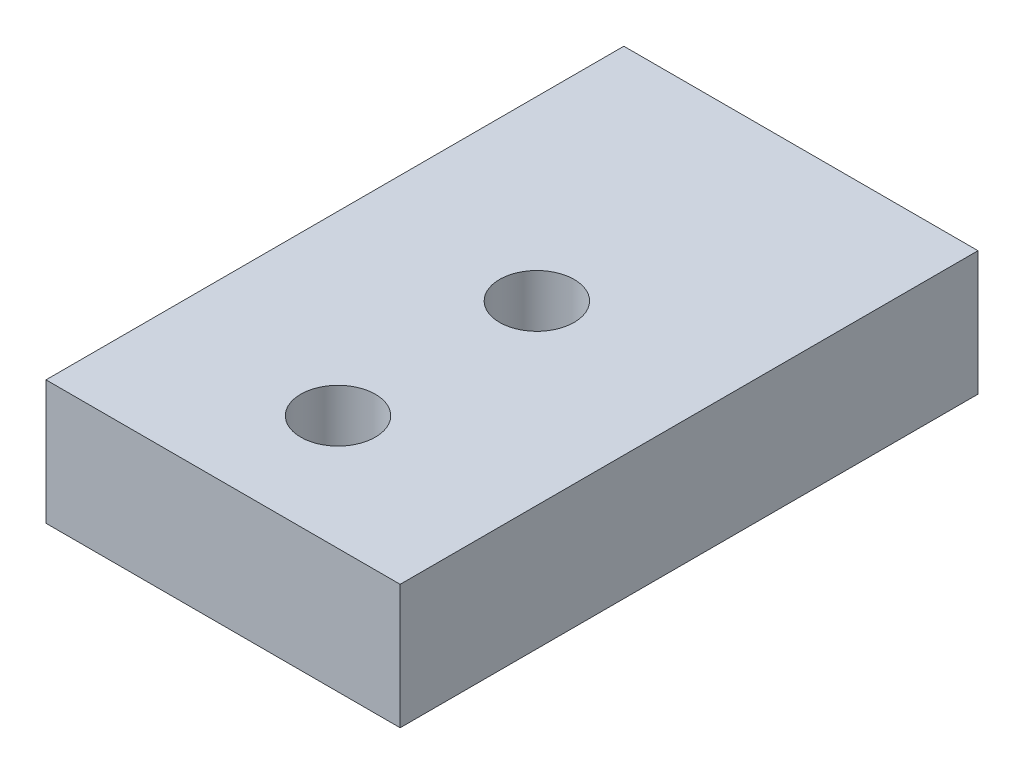
from build123d import *

# Parameters (mm, degrees)
SKETCH1_W           = 28.5
SKETCH1_H           = 46.5
SKETCH1_R           = 3
BOSS_EXTRUDE1_DEPTH = 10


with BuildPart() as part:
    # Sketch1 → Boss-Extrude1 (new body)
    with BuildSketch(Plane(origin=(0, 0, 0), x_dir=(1, 0, 0), z_dir=(0, 1, 0))):
        with Locations((0, -2)):
            Rectangle(SKETCH1_W, SKETCH1_H)
        Circle(SKETCH1_R, mode=Mode.SUBTRACT)
        with Locations((0, -16)):
            Circle(SKETCH1_R, mode=Mode.SUBTRACT)
    extrude(amount=BOSS_EXTRUDE1_DEPTH)


solid = part.part
